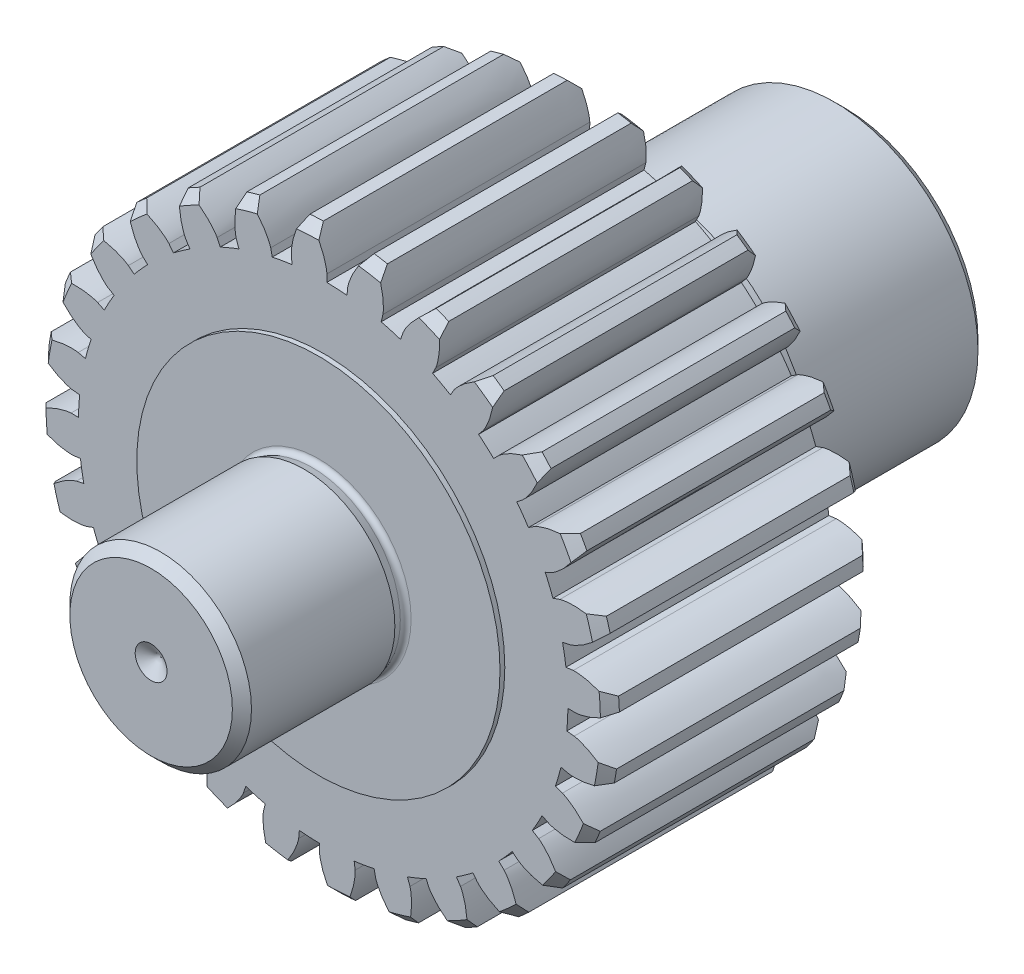
from build123d import *
from build123d.topology import SkipClean

# Parameters (mm, degrees)
CUT_EXTRUDE1_START = -72.5
CUT_EXTRUDE1_DEPTH = 72.5
CUT_EXTRUDE2_START = -25
CUT_EXTRUDE2_DEPTH = 25


with BuildPart() as part:
    # Sketch1 → Revolve1 (revolve)
    with BuildSketch(Plane(origin=(0, 0, 0), x_dir=(0, 0, -1), z_dir=(1, 0, 0))):
        with BuildLine():
            Line((1, 0), (0, 1.664279482))
            Line((0, 1.664279482), (0, 8.5))
            Line((0, 8.5), (1, 9.5))
            Line((1, 9.5), (16, 9.5))
            Line((16, 9.5), (16.845078792, 9.224606038))
            ThreePointArc((16.845078792, 9.224606038), (17.293717038, 9.295363988), (17.5, 9.7))
            Line((17.5, 9.7), (17.5, 19))
            Line((17.5, 19), (18, 19))
            Line((18, 19), (18, 29))
            Line((18, 29), (19, 30))
            Line((19, 30), (44.5, 30))
            Line((44.5, 30), (45.5, 29))
            Line((45.5, 29), (45.5, 18))
            Line((45.5, 18), (51.5, 18))
            Line((51.5, 18), (51.5, 15.15))
            ThreePointArc((51.5, 15.15), (51.691002015, 14.756909368), (52.118080981, 14.664143147))
            Line((52.118080981, 14.664143147), (53.5, 15))
            Line((53.5, 15), (71.5, 15))
            Line((71.5, 15), (72.5, 14))
            Line((72.5, 14), (72.5, 9.177350269))
            Line((72.5, 9.177350269), (71.5, 8.6))
            Line((71.5, 8.6), (67.5, 8.6))
            Line((67.5, 8.6), (66.576239569, 7))
            Line((66.576239569, 7), (50.923760431, 7))
            Line((50.923760431, 7), (50, 8.6))
            Line((50, 8.6), (46, 8.6))
            Line((46, 8.6), (40.832598676, 0))
            Line((40.832598676, 0), (1, 0))
        make_face()
    revolve(axis=Axis((0, 0, 0), (0, 0, -1)))

    # Sketch3 → Cut-Extrude1 (cut)
    with BuildSketch(Plane.XY.offset(CUT_EXTRUDE1_START)):
        with BuildLine():
            add(Edge.make_bspline(
                [(-0.977331043, 29.984076174), (-0.885897241, 29.829762293), (-0.648918395, 29.410274054), (-0.330704202, 28.744625937), (-0.001857606, 28.049280471), (0.186623595, 27.448352917), (0.323198987, 26.907146542), (0.377676599, 26.562123625), (0.389875383, 26.376777171)],
                knots=[0.437527056, 0.437527056, 0.437527056, 0.437527056, 0.515358811, 0.646608382, 0.757768736, 0.848729021, 0.919420974, 1, 1, 1, 1], degree=3))
            Line((0.389875383, 26.376777171), (0.378352504, 25.597203937))
            ThreePointArc((0.378352504, 25.597203937), (1.436130374, 25.559685631), (2.491453258, 25.478474457))
            Line((2.491453258, 25.478474457), (2.567331478, 26.254431737))
            add(Edge.make_bspline(
                [(4.330025689, 29.685869998), (4.221881001, 29.542769901), (3.939402275, 29.152468556), (3.5486244, 28.526656845), (3.143954327, 27.872525711), (2.889342952, 27.296494345), (2.693000709, 26.773993722), (2.600216176, 26.43724507), (2.567331478, 26.254431737)],
                knots=[0.437527061, 0.437527061, 0.437527061, 0.437527061, 0.515358811, 0.646608382, 0.757768736, 0.848729021, 0.919420974, 1, 1, 1, 1], degree=3))
            ThreePointArc((4.330025689, 29.685869998), (1.682965263, 29.9527566), (-0.977331043, 29.984076174))
        make_face()
        with BuildLine():
            ThreePointArc((-5.32704731, 25.039619944), (-4.287441532, 25.23842002), (-3.240506609, 25.394076414))
            Line((-3.240506609, 25.394076414), (-3.339197553, 26.167463317))
            add(Edge.make_bspline(
                [(-2.384264613, 29.905104619), (-2.45785512, 29.741527883), (-2.646401295, 29.298154777), (-2.888125346, 28.601077215), (-3.137091625, 27.873298951), (-3.257140324, 27.255053534), (-3.33229253, 26.701962833), (-3.347817137, 26.353010672), (-3.339197553, 26.167463317)],
                knots=[0.437527061, 0.437527061, 0.437527061, 0.437527061, 0.515358811, 0.646608382, 0.757768736, 0.848729021, 0.919420974, 1, 1, 1, 1], degree=3))
            ThreePointArc((-2.384264613, 29.905104619), (-5.024345563, 29.576273458), (-7.624911948, 29.014836167))
            add(Edge.make_bspline(
                [(-7.624911948, 29.014836167), (-7.501432513, 28.884737191), (-7.177050306, 28.528499153), (-6.718693767, 27.950349544), (-6.243363119, 27.345613091), (-5.925888575, 26.801693059), (-5.672307665, 26.304446742), (-5.542421099, 25.980196678), (-5.489284698, 25.802211732)],
                knots=[0.437527056, 0.437527056, 0.437527056, 0.437527056, 0.515358811, 0.646608382, 0.757768736, 0.848729021, 0.919420974, 1, 1, 1, 1], degree=3))
            Line((-5.489284698, 25.802211732), (-5.32704731, 25.039619944))
        make_face()
        with BuildLine():
            Line((6.249485484, 25.628700863), (6.064780143, 24.871237239))
            ThreePointArc((6.064780143, 24.871237239), (7.087688705, 24.599281876), (8.098481255, 24.285275402))
            Line((8.098481255, 24.285275402), (8.345123789, 25.024893321))
            add(Edge.make_bspline(
                [(10.827190422, 27.978061898), (10.68991438, 27.862614077), (10.327667765, 27.54495583), (9.807431302, 27.021790783), (9.267349281, 26.474107645), (8.890942507, 25.96917495), (8.583255647, 25.503464767), (8.417863792, 25.195805608), (8.345123789, 25.024893321)],
                knots=[0.437527061, 0.437527061, 0.437527061, 0.437527061, 0.515358811, 0.646608382, 0.757768736, 0.848729021, 0.919420974, 1, 1, 1, 1], degree=3))
            ThreePointArc((10.827190422, 27.978061898), (8.305885183, 28.827283454), (5.719257321, 29.4497894))
            add(Edge.make_bspline(
                [(5.719257321, 29.4497894), (5.774060617, 29.278998554), (5.911752995, 28.817295008), (6.073868253, 28.097526759), (6.239741055, 27.346439804), (6.289777678, 26.718637745), (6.302499092, 26.160609661), (6.278836015, 25.812114779), (6.249485484, 25.628700863)],
                knots=[0.437527056, 0.437527056, 0.437527056, 0.437527056, 0.515358811, 0.646608382, 0.757768736, 0.848729021, 0.919420974, 1, 1, 1, 1], degree=3))
        make_face()
        with BuildLine():
            ThreePointArc((-10.765326728, 23.226444851), (-9.796023215, 23.651594643), (-8.809973943, 24.036313343))
            Line((-8.809973943, 24.036313343), (-9.078285275, 24.768349021))
            add(Edge.make_bspline(
                [(-8.978997931, 28.624772421), (-9.014344123, 28.448921467), (-9.099503254, 27.97470918), (-9.180052428, 27.241320146), (-9.260830703, 26.476388594), (-9.240296983, 25.846930531), (-9.190490707, 25.29098403), (-9.127976919, 24.947326278), (-9.078285275, 24.768349021)],
                knots=[0.437527061, 0.437527061, 0.437527061, 0.437527061, 0.515358811, 0.646608382, 0.757768736, 0.848729021, 0.919420974, 1, 1, 1, 1], degree=3))
            ThreePointArc((-8.978997931, 28.624772421), (-11.479714722, 27.716712465), (-13.890147928, 26.590671118))
            add(Edge.make_bspline(
                [(-13.890147928, 26.590671118), (-13.740814635, 26.491310755), (-13.345294947, 26.21618618), (-12.769779972, 25.754525913), (-12.171800335, 25.270722486), (-11.741251947, 24.811084396), (-11.383381125, 24.382732143), (-11.18459866, 24.095514186), (-11.093189123, 23.933815656)],
                knots=[0.437527056, 0.437527056, 0.437527056, 0.437527056, 0.515358811, 0.646608382, 0.757768736, 0.848729021, 0.919420974, 1, 1, 1, 1], degree=3))
            Line((-11.093189123, 23.933815656), (-10.765326728, 23.226444851))
        make_face()
        with BuildLine():
            Line((11.795720287, 23.595494478), (11.447094382, 22.898122853))
            ThreePointArc((11.447094382, 22.898122853), (12.383840729, 22.40536741), (13.299417586, 21.874311232))
            Line((13.299417586, 21.874311232), (13.704456746, 22.540502258))
            add(Edge.make_bspline(
                [(16.781434616, 24.867316948), (16.621910814, 24.785310438), (16.198060869, 24.556224002), (15.574452645, 24.161939299), (14.926040645, 23.748167276), (14.446713079, 23.339652684), (14.043110307, 22.954085596), (13.813404567, 22.690943245), (13.704456746, 22.540502258)],
                knots=[0.437527061, 0.437527061, 0.437527061, 0.437527061, 0.515358811, 0.646608382, 0.757768736, 0.848729021, 0.919420974, 1, 1, 1, 1], degree=3))
            ThreePointArc((16.781434616, 24.867316948), (14.512313338, 26.256289943), (12.129058241, 27.438767213))
            add(Edge.make_bspline(
                [(12.129058241, 27.438767213), (12.144482966, 27.26006357), (12.175984404, 26.779296459), (12.173871591, 26.041500265), (12.168453045, 25.272334456), (12.077536045, 24.64913851), (11.965765576, 24.102270574), (11.865148375, 23.767778716), (11.795720287, 23.595494478)],
                knots=[0.437527056, 0.437527056, 0.437527056, 0.437527056, 0.515358811, 0.646608382, 0.757768736, 0.848729021, 0.919420974, 1, 1, 1, 1], degree=3))
        make_face()
        with BuildLine():
            ThreePointArc((-15.663787712, 20.248598828), (-14.813391391, 20.87877955), (-13.937672397, 21.473269154))
            Line((-13.937672397, 21.473269154), (-14.362149866, 22.127246281))
            add(Edge.make_bspline(
                [(-15.1234868, 25.909074608), (-15.11881627, 25.729767337), (-15.096318123, 25.248494852), (-15.011653348, 24.515569535), (-14.92019306, 23.751841557), (-14.760106567, 23.142734504), (-14.587839304, 22.611809681), (-14.450421823, 22.290678774), (-14.362149866, 22.127246281)],
                knots=[0.437527061, 0.437527061, 0.437527061, 0.437527061, 0.515358811, 0.646608382, 0.757768736, 0.848729021, 0.919420974, 1, 1, 1, 1], degree=3))
            ThreePointArc((-15.1234868, 25.909074608), (-17.359443051, 24.467319775), (-19.458873891, 22.833138787))
            add(Edge.make_bspline(
                [(-19.458873891, 22.833138787), (-19.291174935, 22.769499379), (-18.844350773, 22.589284162), (-18.180536087, 22.267262812), (-17.489892658, 21.928652334), (-16.967859919, 21.576344361), (-16.523644323, 21.238365542), (-16.265933741, 21.002581999), (-16.140834724, 20.865278124)],
                knots=[0.437527056, 0.437527056, 0.437527056, 0.437527056, 0.515358811, 0.646608382, 0.757768736, 0.848729021, 0.919420974, 1, 1, 1, 1], degree=3))
            Line((-16.140834724, 20.865278124), (-15.663787712, 20.248598828))
        make_face()
        with BuildLine():
            Line((16.750468421, 20.379111474), (16.255403509, 19.776800973))
            ThreePointArc((16.255403509, 19.776800973), (17.059015269, 19.087954266), (17.833465585, 18.366477758))
            Line((17.833465585, 18.366477758), (18.376591017, 18.925836292))
            add(Edge.make_bspline(
                [(21.894187606, 20.50962089), (21.720415234, 20.465167839), (21.256215564, 20.336140565), (20.5605059, 20.090507287), (19.836278005, 19.831394636), (19.278065134, 19.539782776), (18.798784777, 19.253692725), (18.516283558, 19.048262237), (18.376591017, 18.925836292)],
                knots=[0.437527061, 0.437527061, 0.437527061, 0.437527061, 0.515358811, 0.646608382, 0.757768736, 0.848729021, 0.919420974, 1, 1, 1, 1], degree=3))
            ThreePointArc((21.894187606, 20.50962089), (19.991033504, 22.368696418), (17.930657534, 24.051850664))
            add(Edge.make_bspline(
                [(17.930657534, 24.051850664), (17.905930228, 23.87419517), (17.829661112, 23.398472165), (17.663426174, 22.679644207), (17.486987988, 21.930968731), (17.259676323, 21.343628544), (17.029018609, 20.835342998), (16.856492651, 20.531626983), (16.750468421, 20.379111474)],
                knots=[0.437527056, 0.437527056, 0.437527056, 0.437527056, 0.515358811, 0.646608382, 0.757768736, 0.848729021, 0.919420974, 1, 1, 1, 1], degree=3))
        make_face()
        with BuildLine():
            ThreePointArc((-19.776800973, 16.255403509), (-19.087954266, 17.059015269), (-18.366477758, 17.833465585))
            Line((-18.366477758, 17.833465585), (-18.925836292, 18.376591017))
            add(Edge.make_bspline(
                [(-20.50962089, 21.894187606), (-20.465167839, 21.720415234), (-20.336140565, 21.256215564), (-20.090507287, 20.5605059), (-19.831394636, 19.836278005), (-19.539782776, 19.278065134), (-19.253692725, 18.798784777), (-19.048262237, 18.516283558), (-18.925836292, 18.376591017)],
                knots=[0.437527061, 0.437527061, 0.437527061, 0.437527061, 0.515358811, 0.646608382, 0.757768736, 0.848729021, 0.919420974, 1, 1, 1, 1], degree=3))
            ThreePointArc((-20.50962089, 21.894187606), (-22.368696418, 19.991033504), (-24.051850664, 17.930657534))
            add(Edge.make_bspline(
                [(-24.051850664, 17.930657534), (-23.87419517, 17.905930228), (-23.398472165, 17.829661112), (-22.679644207, 17.663426174), (-21.930968731, 17.486987988), (-21.343628544, 17.259676323), (-20.835342998, 17.029018609), (-20.531626983, 16.856492651), (-20.379111474, 16.750468421)],
                knots=[0.437527056, 0.437527056, 0.437527056, 0.437527056, 0.515358811, 0.646608382, 0.757768736, 0.848729021, 0.919420974, 1, 1, 1, 1], degree=3))
            Line((-20.379111474, 16.750468421), (-19.776800973, 16.255403509))
        make_face()
        with BuildLine():
            Line((20.865278124, 16.140834724), (20.248598828, 15.663787712))
            ThreePointArc((20.248598828, 15.663787712), (20.87877955, 14.813391391), (21.473269154, 13.937672397))
            Line((21.473269154, 13.937672397), (22.127246281, 14.362149866))
            add(Edge.make_bspline(
                [(25.909074608, 15.1234868), (25.729767337, 15.11881627), (25.248494852, 15.096318123), (24.515569535, 15.011653348), (23.751841557, 14.92019306), (23.142734504, 14.760106567), (22.611809681, 14.587839304), (22.290678774, 14.450421823), (22.127246281, 14.362149866)],
                knots=[0.437527061, 0.437527061, 0.437527061, 0.437527061, 0.515358811, 0.646608382, 0.757768736, 0.848729021, 0.919420974, 1, 1, 1, 1], degree=3))
            ThreePointArc((25.909074608, 15.1234868), (24.467319775, 17.359443051), (22.833138787, 19.458873891))
            add(Edge.make_bspline(
                [(22.833138787, 19.458873891), (22.769499379, 19.291174935), (22.589284162, 18.844350773), (22.267262812, 18.180536087), (21.928652334, 17.489892658), (21.576344361, 16.967859919), (21.238365542, 16.523644323), (21.002581999, 16.265933741), (20.865278124, 16.140834724)],
                knots=[0.437527056, 0.437527056, 0.437527056, 0.437527056, 0.515358811, 0.646608382, 0.757768736, 0.848729021, 0.919420974, 1, 1, 1, 1], degree=3))
        make_face()
        with BuildLine():
            ThreePointArc((-22.898122853, 11.447094382), (-22.40536741, 12.383840729), (-21.874311232, 13.299417586))
            Line((-21.874311232, 13.299417586), (-22.540502258, 13.704456746))
            add(Edge.make_bspline(
                [(-24.867316948, 16.781434616), (-24.785310438, 16.621910814), (-24.556224002, 16.198060869), (-24.161939299, 15.574452645), (-23.748167276, 14.926040645), (-23.339652684, 14.446713079), (-22.954085596, 14.043110307), (-22.690943245, 13.813404567), (-22.540502258, 13.704456746)],
                knots=[0.437527061, 0.437527061, 0.437527061, 0.437527061, 0.515358811, 0.646608382, 0.757768736, 0.848729021, 0.919420974, 1, 1, 1, 1], degree=3))
            ThreePointArc((-24.867316948, 16.781434616), (-26.256289943, 14.512313338), (-27.438767213, 12.129058241))
            add(Edge.make_bspline(
                [(-27.438767213, 12.129058241), (-27.26006357, 12.144482966), (-26.779296459, 12.175984404), (-26.041500265, 12.173871591), (-25.272334456, 12.168453045), (-24.64913851, 12.077536045), (-24.102270574, 11.965765576), (-23.767778716, 11.865148375), (-23.595494478, 11.795720287)],
                knots=[0.437527056, 0.437527056, 0.437527056, 0.437527056, 0.515358811, 0.646608382, 0.757768736, 0.848729021, 0.919420974, 1, 1, 1, 1], degree=3))
            Line((-23.595494478, 11.795720287), (-22.898122853, 11.447094382))
        make_face()
        with BuildLine():
            Line((23.933815656, 11.093189123), (23.226444851, 10.765326728))
            ThreePointArc((23.226444851, 10.765326728), (23.651594643, 9.796023215), (24.036313343, 8.809973943))
            Line((24.036313343, 8.809973943), (24.768349021, 9.078285275))
            add(Edge.make_bspline(
                [(28.624772421, 8.978997931), (28.448921467, 9.014344123), (27.97470918, 9.099503254), (27.241320146, 9.180052428), (26.476388594, 9.260830703), (25.846930531, 9.240296983), (25.29098403, 9.190490707), (24.947326278, 9.127976919), (24.768349021, 9.078285275)],
                knots=[0.437527061, 0.437527061, 0.437527061, 0.437527061, 0.515358811, 0.646608382, 0.757768736, 0.848729021, 0.919420974, 1, 1, 1, 1], degree=3))
            ThreePointArc((28.624772421, 8.978997931), (27.716712465, 11.479714722), (26.590671118, 13.890147928))
            add(Edge.make_bspline(
                [(26.590671118, 13.890147928), (26.491310755, 13.740814635), (26.21618618, 13.345294947), (25.754525913, 12.769779972), (25.270722486, 12.171800335), (24.811084396, 11.741251947), (24.382732143, 11.383381125), (24.095514186, 11.18459866), (23.933815656, 11.093189123)],
                knots=[0.437527056, 0.437527056, 0.437527056, 0.437527056, 0.515358811, 0.646608382, 0.757768736, 0.848729021, 0.919420974, 1, 1, 1, 1], degree=3))
        make_face()
        with BuildLine():
            ThreePointArc((-24.871237239, 6.064780143), (-24.599281876, 7.087688705), (-24.285275402, 8.098481255))
            Line((-24.285275402, 8.098481255), (-25.024893321, 8.345123789))
            add(Edge.make_bspline(
                [(-27.978061898, 10.827190422), (-27.862614077, 10.68991438), (-27.54495583, 10.327667765), (-27.021790783, 9.807431302), (-26.474107645, 9.267349281), (-25.96917495, 8.890942507), (-25.503464767, 8.583255647), (-25.195805608, 8.417863792), (-25.024893321, 8.345123789)],
                knots=[0.437527061, 0.437527061, 0.437527061, 0.437527061, 0.515358811, 0.646608382, 0.757768736, 0.848729021, 0.919420974, 1, 1, 1, 1], degree=3))
            ThreePointArc((-27.978061898, 10.827190422), (-28.827283454, 8.305885183), (-29.4497894, 5.719257321))
            add(Edge.make_bspline(
                [(-29.4497894, 5.719257321), (-29.278998554, 5.774060617), (-28.817295008, 5.911752995), (-28.097526759, 6.073868253), (-27.346439804, 6.239741055), (-26.718637745, 6.289777678), (-26.160609661, 6.302499092), (-25.812114779, 6.278836015), (-25.628700863, 6.249485484)],
                knots=[0.437527056, 0.437527056, 0.437527056, 0.437527056, 0.515358811, 0.646608382, 0.757768736, 0.848729021, 0.919420974, 1, 1, 1, 1], degree=3))
            Line((-25.628700863, 6.249485484), (-24.871237239, 6.064780143))
        make_face()
        with BuildLine():
            Line((25.802211732, 5.489284698), (25.039619944, 5.32704731))
            ThreePointArc((25.039619944, 5.32704731), (25.23842002, 4.287441532), (25.394076414, 3.240506609))
            Line((25.394076414, 3.240506609), (26.167463317, 3.339197553))
            add(Edge.make_bspline(
                [(29.905104619, 2.384264613), (29.741527883, 2.45785512), (29.298154777, 2.646401295), (28.601077215, 2.888125346), (27.873298951, 3.137091625), (27.255053534, 3.257140324), (26.701962833, 3.33229253), (26.353010672, 3.347817137), (26.167463317, 3.339197553)],
                knots=[0.437527061, 0.437527061, 0.437527061, 0.437527061, 0.515358811, 0.646608382, 0.757768736, 0.848729021, 0.919420974, 1, 1, 1, 1], degree=3))
            ThreePointArc((29.905104619, 2.384264613), (29.576273458, 5.024345563), (29.014836167, 7.624911948))
            add(Edge.make_bspline(
                [(29.014836167, 7.624911948), (28.884737191, 7.501432513), (28.528499153, 7.177050306), (27.950349544, 6.718693767), (27.345613091, 6.243363119), (26.801693059, 5.925888575), (26.304446742, 5.672307665), (25.980196678, 5.542421099), (25.802211732, 5.489284698)],
                knots=[0.437527056, 0.437527056, 0.437527056, 0.437527056, 0.515358811, 0.646608382, 0.757768736, 0.848729021, 0.919420974, 1, 1, 1, 1], degree=3))
        make_face()
        with BuildLine():
            ThreePointArc((-25.597203937, 0.378352504), (-25.559685631, 1.436130374), (-25.478474457, 2.491453258))
            Line((-25.478474457, 2.491453258), (-26.254431737, 2.567331478))
            add(Edge.make_bspline(
                [(-29.685869998, 4.330025689), (-29.542769901, 4.221881001), (-29.152468556, 3.939402275), (-28.526656845, 3.5486244), (-27.872525711, 3.143954327), (-27.296494345, 2.889342952), (-26.773993722, 2.693000709), (-26.43724507, 2.600216176), (-26.254431737, 2.567331478)],
                knots=[0.437527061, 0.437527061, 0.437527061, 0.437527061, 0.515358811, 0.646608382, 0.757768736, 0.848729021, 0.919420974, 1, 1, 1, 1], degree=3))
            ThreePointArc((-29.685869998, 4.330025689), (-29.9527566, 1.682965263), (-29.984076174, -0.977331043))
            add(Edge.make_bspline(
                [(-29.984076174, -0.977331043), (-29.829762293, -0.885897241), (-29.410274054, -0.648918395), (-28.744625937, -0.330704202), (-28.049280471, -0.001857606), (-27.448352917, 0.186623595), (-26.907146542, 0.323198987), (-26.562123625, 0.377676599), (-26.376777171, 0.389875383)],
                knots=[0.437527056, 0.437527056, 0.437527056, 0.437527056, 0.515358811, 0.646608382, 0.757768736, 0.848729021, 0.919420974, 1, 1, 1, 1], degree=3))
            Line((-26.376777171, 0.389875383), (-25.597203937, 0.378352504))
        make_face()
        with BuildLine():
            ThreePointArc((29.685869998, -4.330025689), (29.9527566, -1.682965263), (29.984076174, 0.977331043))
            add(Edge.make_bspline(
                [(29.984076174, 0.977331043), (29.829762293, 0.885897241), (29.410274054, 0.648918395), (28.744625937, 0.330704202), (28.049280471, 0.001857606), (27.448352917, -0.186623595), (26.907146542, -0.323198987), (26.562123625, -0.377676599), (26.376777171, -0.389875383)],
                knots=[0.437527056, 0.437527056, 0.437527056, 0.437527056, 0.515358811, 0.646608382, 0.757768736, 0.848729021, 0.919420974, 1, 1, 1, 1], degree=3))
            Line((26.376777171, -0.389875383), (25.597203937, -0.378352504))
            ThreePointArc((25.597203937, -0.378352504), (25.559685631, -1.436130374), (25.478474457, -2.491453258))
            Line((25.478474457, -2.491453258), (26.254431737, -2.567331478))
            add(Edge.make_bspline(
                [(29.685869998, -4.330025689), (29.542769901, -4.221881001), (29.152468556, -3.939402275), (28.526656845, -3.5486244), (27.872525711, -3.143954327), (27.296494345, -2.889342952), (26.773993722, -2.693000709), (26.43724507, -2.600216176), (26.254431737, -2.567331478)],
                knots=[0.437527061, 0.437527061, 0.437527061, 0.437527061, 0.515358811, 0.646608382, 0.757768736, 0.848729021, 0.919420974, 1, 1, 1, 1], degree=3))
        make_face()
        with BuildLine():
            ThreePointArc((-25.039619944, -5.32704731), (-25.23842002, -4.287441532), (-25.394076414, -3.240506609))
            Line((-25.394076414, -3.240506609), (-26.167463317, -3.339197553))
            add(Edge.make_bspline(
                [(-29.905104619, -2.384264613), (-29.741527883, -2.45785512), (-29.298154777, -2.646401295), (-28.601077215, -2.888125346), (-27.873298951, -3.137091625), (-27.255053534, -3.257140324), (-26.701962833, -3.33229253), (-26.353010672, -3.347817137), (-26.167463317, -3.339197553)],
                knots=[0.437527061, 0.437527061, 0.437527061, 0.437527061, 0.515358811, 0.646608382, 0.757768736, 0.848729021, 0.919420974, 1, 1, 1, 1], degree=3))
            ThreePointArc((-29.905104619, -2.384264613), (-29.576273458, -5.024345563), (-29.014836167, -7.624911948))
            add(Edge.make_bspline(
                [(-29.014836167, -7.624911948), (-28.884737191, -7.501432513), (-28.528499153, -7.177050306), (-27.950349544, -6.718693767), (-27.345613091, -6.243363119), (-26.801693059, -5.925888575), (-26.304446742, -5.672307665), (-25.980196678, -5.542421099), (-25.802211732, -5.489284698)],
                knots=[0.437527056, 0.437527056, 0.437527056, 0.437527056, 0.515358811, 0.646608382, 0.757768736, 0.848729021, 0.919420974, 1, 1, 1, 1], degree=3))
            Line((-25.802211732, -5.489284698), (-25.039619944, -5.32704731))
        make_face()
        with BuildLine():
            Line((25.628700863, -6.249485484), (24.871237239, -6.064780143))
            ThreePointArc((24.871237239, -6.064780143), (24.599281876, -7.087688705), (24.285275402, -8.098481255))
            Line((24.285275402, -8.098481255), (25.024893321, -8.345123789))
            add(Edge.make_bspline(
                [(27.978061898, -10.827190422), (27.862614077, -10.68991438), (27.54495583, -10.327667765), (27.021790783, -9.807431302), (26.474107645, -9.267349281), (25.96917495, -8.890942507), (25.503464767, -8.583255647), (25.195805608, -8.417863792), (25.024893321, -8.345123789)],
                knots=[0.437527061, 0.437527061, 0.437527061, 0.437527061, 0.515358811, 0.646608382, 0.757768736, 0.848729021, 0.919420974, 1, 1, 1, 1], degree=3))
            ThreePointArc((27.978061898, -10.827190422), (28.827283454, -8.305885183), (29.4497894, -5.719257321))
            add(Edge.make_bspline(
                [(29.4497894, -5.719257321), (29.278998554, -5.774060617), (28.817295008, -5.911752995), (28.097526759, -6.073868253), (27.346439804, -6.239741055), (26.718637745, -6.289777678), (26.160609661, -6.302499092), (25.812114779, -6.278836015), (25.628700863, -6.249485484)],
                knots=[0.437527056, 0.437527056, 0.437527056, 0.437527056, 0.515358811, 0.646608382, 0.757768736, 0.848729021, 0.919420974, 1, 1, 1, 1], degree=3))
        make_face()
        with BuildLine():
            ThreePointArc((-23.226444851, -10.765326728), (-23.651594643, -9.796023215), (-24.036313343, -8.809973943))
            Line((-24.036313343, -8.809973943), (-24.768349021, -9.078285275))
            add(Edge.make_bspline(
                [(-28.624772421, -8.978997931), (-28.448921467, -9.014344123), (-27.97470918, -9.099503254), (-27.241320146, -9.180052428), (-26.476388594, -9.260830703), (-25.846930531, -9.240296983), (-25.29098403, -9.190490707), (-24.947326278, -9.127976919), (-24.768349021, -9.078285275)],
                knots=[0.437527061, 0.437527061, 0.437527061, 0.437527061, 0.515358811, 0.646608382, 0.757768736, 0.848729021, 0.919420974, 1, 1, 1, 1], degree=3))
            ThreePointArc((-28.624772421, -8.978997931), (-27.716712465, -11.479714722), (-26.590671118, -13.890147928))
            add(Edge.make_bspline(
                [(-26.590671118, -13.890147928), (-26.491310755, -13.740814635), (-26.21618618, -13.345294947), (-25.754525913, -12.769779972), (-25.270722486, -12.171800335), (-24.811084396, -11.741251947), (-24.382732143, -11.383381125), (-24.095514186, -11.18459866), (-23.933815656, -11.093189123)],
                knots=[0.437527056, 0.437527056, 0.437527056, 0.437527056, 0.515358811, 0.646608382, 0.757768736, 0.848729021, 0.919420974, 1, 1, 1, 1], degree=3))
            Line((-23.933815656, -11.093189123), (-23.226444851, -10.765326728))
        make_face()
        with BuildLine():
            Line((23.595494478, -11.795720287), (22.898122853, -11.447094382))
            ThreePointArc((22.898122853, -11.447094382), (22.40536741, -12.383840729), (21.874311232, -13.299417586))
            Line((21.874311232, -13.299417586), (22.540502258, -13.704456746))
            add(Edge.make_bspline(
                [(24.867316948, -16.781434616), (24.785310438, -16.621910814), (24.556224002, -16.198060869), (24.161939299, -15.574452645), (23.748167276, -14.926040645), (23.339652684, -14.446713079), (22.954085596, -14.043110307), (22.690943245, -13.813404567), (22.540502258, -13.704456746)],
                knots=[0.437527061, 0.437527061, 0.437527061, 0.437527061, 0.515358811, 0.646608382, 0.757768736, 0.848729021, 0.919420974, 1, 1, 1, 1], degree=3))
            ThreePointArc((24.867316948, -16.781434616), (26.256289943, -14.512313338), (27.438767213, -12.129058241))
            add(Edge.make_bspline(
                [(27.438767213, -12.129058241), (27.26006357, -12.144482966), (26.779296459, -12.175984404), (26.041500265, -12.173871591), (25.272334456, -12.168453045), (24.64913851, -12.077536045), (24.102270574, -11.965765576), (23.767778716, -11.865148375), (23.595494478, -11.795720287)],
                knots=[0.437527056, 0.437527056, 0.437527056, 0.437527056, 0.515358811, 0.646608382, 0.757768736, 0.848729021, 0.919420974, 1, 1, 1, 1], degree=3))
        make_face()
        with BuildLine():
            ThreePointArc((-20.248598828, -15.663787712), (-20.87877955, -14.813391391), (-21.473269154, -13.937672397))
            Line((-21.473269154, -13.937672397), (-22.127246281, -14.362149866))
            add(Edge.make_bspline(
                [(-25.909074608, -15.1234868), (-25.729767337, -15.11881627), (-25.248494852, -15.096318123), (-24.515569535, -15.011653348), (-23.751841557, -14.92019306), (-23.142734504, -14.760106567), (-22.611809681, -14.587839304), (-22.290678774, -14.450421823), (-22.127246281, -14.362149866)],
                knots=[0.437527061, 0.437527061, 0.437527061, 0.437527061, 0.515358811, 0.646608382, 0.757768736, 0.848729021, 0.919420974, 1, 1, 1, 1], degree=3))
            ThreePointArc((-25.909074608, -15.1234868), (-24.467319775, -17.359443051), (-22.833138787, -19.458873891))
            add(Edge.make_bspline(
                [(-22.833138787, -19.458873891), (-22.769499379, -19.291174935), (-22.589284162, -18.844350773), (-22.267262812, -18.180536087), (-21.928652334, -17.489892658), (-21.576344361, -16.967859919), (-21.238365542, -16.523644323), (-21.002581999, -16.265933741), (-20.865278124, -16.140834724)],
                knots=[0.437527056, 0.437527056, 0.437527056, 0.437527056, 0.515358811, 0.646608382, 0.757768736, 0.848729021, 0.919420974, 1, 1, 1, 1], degree=3))
            Line((-20.865278124, -16.140834724), (-20.248598828, -15.663787712))
        make_face()
        with BuildLine():
            Line((20.379111474, -16.750468421), (19.776800973, -16.255403509))
            ThreePointArc((19.776800973, -16.255403509), (19.087954266, -17.059015269), (18.366477758, -17.833465585))
            Line((18.366477758, -17.833465585), (18.925836292, -18.376591017))
            add(Edge.make_bspline(
                [(20.50962089, -21.894187606), (20.465167839, -21.720415234), (20.336140565, -21.256215564), (20.090507287, -20.5605059), (19.831394636, -19.836278005), (19.539782776, -19.278065134), (19.253692725, -18.798784777), (19.048262237, -18.516283558), (18.925836292, -18.376591017)],
                knots=[0.437527061, 0.437527061, 0.437527061, 0.437527061, 0.515358811, 0.646608382, 0.757768736, 0.848729021, 0.919420974, 1, 1, 1, 1], degree=3))
            ThreePointArc((20.50962089, -21.894187606), (22.368696418, -19.991033504), (24.051850664, -17.930657534))
            add(Edge.make_bspline(
                [(24.051850664, -17.930657534), (23.87419517, -17.905930228), (23.398472165, -17.829661112), (22.679644207, -17.663426174), (21.930968731, -17.486987988), (21.343628544, -17.259676323), (20.835342998, -17.029018609), (20.531626983, -16.856492651), (20.379111474, -16.750468421)],
                knots=[0.437527056, 0.437527056, 0.437527056, 0.437527056, 0.515358811, 0.646608382, 0.757768736, 0.848729021, 0.919420974, 1, 1, 1, 1], degree=3))
        make_face()
        with BuildLine():
            ThreePointArc((-16.255403509, -19.776800973), (-17.059015269, -19.087954266), (-17.833465585, -18.366477758))
            Line((-17.833465585, -18.366477758), (-18.376591017, -18.925836292))
            add(Edge.make_bspline(
                [(-21.894187606, -20.50962089), (-21.720415234, -20.465167839), (-21.256215564, -20.336140565), (-20.5605059, -20.090507287), (-19.836278005, -19.831394636), (-19.278065134, -19.539782776), (-18.798784777, -19.253692725), (-18.516283558, -19.048262237), (-18.376591017, -18.925836292)],
                knots=[0.437527061, 0.437527061, 0.437527061, 0.437527061, 0.515358811, 0.646608382, 0.757768736, 0.848729021, 0.919420974, 1, 1, 1, 1], degree=3))
            ThreePointArc((-21.894187606, -20.50962089), (-19.991033504, -22.368696418), (-17.930657534, -24.051850664))
            add(Edge.make_bspline(
                [(-17.930657534, -24.051850664), (-17.905930228, -23.87419517), (-17.829661112, -23.398472165), (-17.663426174, -22.679644207), (-17.486987988, -21.930968731), (-17.259676323, -21.343628544), (-17.029018609, -20.835342998), (-16.856492651, -20.531626983), (-16.750468421, -20.379111474)],
                knots=[0.437527056, 0.437527056, 0.437527056, 0.437527056, 0.515358811, 0.646608382, 0.757768736, 0.848729021, 0.919420974, 1, 1, 1, 1], degree=3))
            Line((-16.750468421, -20.379111474), (-16.255403509, -19.776800973))
        make_face()
        with BuildLine():
            Line((16.140834724, -20.865278124), (15.663787712, -20.248598828))
            ThreePointArc((15.663787712, -20.248598828), (14.813391391, -20.87877955), (13.937672397, -21.473269154))
            Line((13.937672397, -21.473269154), (14.362149866, -22.127246281))
            add(Edge.make_bspline(
                [(15.1234868, -25.909074608), (15.11881627, -25.729767337), (15.096318123, -25.248494852), (15.011653348, -24.515569535), (14.92019306, -23.751841557), (14.760106567, -23.142734504), (14.587839304, -22.611809681), (14.450421823, -22.290678774), (14.362149866, -22.127246281)],
                knots=[0.437527061, 0.437527061, 0.437527061, 0.437527061, 0.515358811, 0.646608382, 0.757768736, 0.848729021, 0.919420974, 1, 1, 1, 1], degree=3))
            ThreePointArc((15.1234868, -25.909074608), (17.359443051, -24.467319775), (19.458873891, -22.833138787))
            add(Edge.make_bspline(
                [(19.458873891, -22.833138787), (19.291174935, -22.769499379), (18.844350773, -22.589284162), (18.180536087, -22.267262812), (17.489892658, -21.928652334), (16.967859919, -21.576344361), (16.523644323, -21.238365542), (16.265933741, -21.002581999), (16.140834724, -20.865278124)],
                knots=[0.437527056, 0.437527056, 0.437527056, 0.437527056, 0.515358811, 0.646608382, 0.757768736, 0.848729021, 0.919420974, 1, 1, 1, 1], degree=3))
        make_face()
        with BuildLine():
            ThreePointArc((-11.447094382, -22.898122853), (-12.383840729, -22.40536741), (-13.299417586, -21.874311232))
            Line((-13.299417586, -21.874311232), (-13.704456746, -22.540502258))
            add(Edge.make_bspline(
                [(-16.781434616, -24.867316948), (-16.621910814, -24.785310438), (-16.198060869, -24.556224002), (-15.574452645, -24.161939299), (-14.926040645, -23.748167276), (-14.446713079, -23.339652684), (-14.043110307, -22.954085596), (-13.813404567, -22.690943245), (-13.704456746, -22.540502258)],
                knots=[0.437527061, 0.437527061, 0.437527061, 0.437527061, 0.515358811, 0.646608382, 0.757768736, 0.848729021, 0.919420974, 1, 1, 1, 1], degree=3))
            ThreePointArc((-16.781434616, -24.867316948), (-14.512313338, -26.256289943), (-12.129058241, -27.438767213))
            add(Edge.make_bspline(
                [(-12.129058241, -27.438767213), (-12.144482966, -27.26006357), (-12.175984404, -26.779296459), (-12.173871591, -26.041500265), (-12.168453045, -25.272334456), (-12.077536045, -24.64913851), (-11.965765576, -24.102270574), (-11.865148375, -23.767778716), (-11.795720287, -23.595494478)],
                knots=[0.437527056, 0.437527056, 0.437527056, 0.437527056, 0.515358811, 0.646608382, 0.757768736, 0.848729021, 0.919420974, 1, 1, 1, 1], degree=3))
            Line((-11.795720287, -23.595494478), (-11.447094382, -22.898122853))
        make_face()
        with BuildLine():
            Line((11.093189123, -23.933815656), (10.765326728, -23.226444851))
            ThreePointArc((10.765326728, -23.226444851), (9.796023215, -23.651594643), (8.809973943, -24.036313343))
            Line((8.809973943, -24.036313343), (9.078285275, -24.768349021))
            add(Edge.make_bspline(
                [(8.978997931, -28.624772421), (9.014344123, -28.448921467), (9.099503254, -27.97470918), (9.180052428, -27.241320146), (9.260830703, -26.476388594), (9.240296983, -25.846930531), (9.190490707, -25.29098403), (9.127976919, -24.947326278), (9.078285275, -24.768349021)],
                knots=[0.437527061, 0.437527061, 0.437527061, 0.437527061, 0.515358811, 0.646608382, 0.757768736, 0.848729021, 0.919420974, 1, 1, 1, 1], degree=3))
            ThreePointArc((8.978997931, -28.624772421), (11.479714722, -27.716712465), (13.890147928, -26.590671118))
            add(Edge.make_bspline(
                [(13.890147928, -26.590671118), (13.740814635, -26.491310755), (13.345294947, -26.21618618), (12.769779972, -25.754525913), (12.171800335, -25.270722486), (11.741251947, -24.811084396), (11.383381125, -24.382732143), (11.18459866, -24.095514186), (11.093189123, -23.933815656)],
                knots=[0.437527056, 0.437527056, 0.437527056, 0.437527056, 0.515358811, 0.646608382, 0.757768736, 0.848729021, 0.919420974, 1, 1, 1, 1], degree=3))
        make_face()
        with BuildLine():
            ThreePointArc((-6.064780143, -24.871237239), (-7.087688705, -24.599281876), (-8.098481255, -24.285275402))
            Line((-8.098481255, -24.285275402), (-8.345123789, -25.024893321))
            add(Edge.make_bspline(
                [(-10.827190422, -27.978061898), (-10.68991438, -27.862614077), (-10.327667765, -27.54495583), (-9.807431302, -27.021790783), (-9.267349281, -26.474107645), (-8.890942507, -25.96917495), (-8.583255647, -25.503464767), (-8.417863792, -25.195805608), (-8.345123789, -25.024893321)],
                knots=[0.437527061, 0.437527061, 0.437527061, 0.437527061, 0.515358811, 0.646608382, 0.757768736, 0.848729021, 0.919420974, 1, 1, 1, 1], degree=3))
            ThreePointArc((-10.827190422, -27.978061898), (-8.305885183, -28.827283454), (-5.719257321, -29.4497894))
            add(Edge.make_bspline(
                [(-5.719257321, -29.4497894), (-5.774060617, -29.278998554), (-5.911752995, -28.817295008), (-6.073868253, -28.097526759), (-6.239741055, -27.346439804), (-6.289777678, -26.718637745), (-6.302499092, -26.160609661), (-6.278836015, -25.812114779), (-6.249485484, -25.628700863)],
                knots=[0.437527056, 0.437527056, 0.437527056, 0.437527056, 0.515358811, 0.646608382, 0.757768736, 0.848729021, 0.919420974, 1, 1, 1, 1], degree=3))
            Line((-6.249485484, -25.628700863), (-6.064780143, -24.871237239))
        make_face()
        with BuildLine():
            Line((5.489284698, -25.802211732), (5.32704731, -25.039619944))
            ThreePointArc((5.32704731, -25.039619944), (4.287441532, -25.23842002), (3.240506609, -25.394076414))
            Line((3.240506609, -25.394076414), (3.339197553, -26.167463317))
            add(Edge.make_bspline(
                [(2.384264613, -29.905104619), (2.45785512, -29.741527883), (2.646401295, -29.298154777), (2.888125346, -28.601077215), (3.137091625, -27.873298951), (3.257140324, -27.255053534), (3.33229253, -26.701962833), (3.347817137, -26.353010672), (3.339197553, -26.167463317)],
                knots=[0.437527061, 0.437527061, 0.437527061, 0.437527061, 0.515358811, 0.646608382, 0.757768736, 0.848729021, 0.919420974, 1, 1, 1, 1], degree=3))
            ThreePointArc((2.384264613, -29.905104619), (5.024345563, -29.576273458), (7.624911948, -29.014836167))
            add(Edge.make_bspline(
                [(7.624911948, -29.014836167), (7.501432513, -28.884737191), (7.177050306, -28.528499153), (6.718693767, -27.950349544), (6.243363119, -27.345613091), (5.925888575, -26.801693059), (5.672307665, -26.304446742), (5.542421099, -25.980196678), (5.489284698, -25.802211732)],
                knots=[0.437527056, 0.437527056, 0.437527056, 0.437527056, 0.515358811, 0.646608382, 0.757768736, 0.848729021, 0.919420974, 1, 1, 1, 1], degree=3))
        make_face()
        with BuildLine():
            ThreePointArc((-0.378352504, -25.597203937), (-1.436130374, -25.559685631), (-2.491453258, -25.478474457))
            Line((-2.491453258, -25.478474457), (-2.567331478, -26.254431737))
            add(Edge.make_bspline(
                [(-4.330025689, -29.685869998), (-4.221881001, -29.542769901), (-3.939402275, -29.152468556), (-3.5486244, -28.526656845), (-3.143954327, -27.872525711), (-2.889342952, -27.296494345), (-2.693000709, -26.773993722), (-2.600216176, -26.43724507), (-2.567331478, -26.254431737)],
                knots=[0.437527061, 0.437527061, 0.437527061, 0.437527061, 0.515358811, 0.646608382, 0.757768736, 0.848729021, 0.919420974, 1, 1, 1, 1], degree=3))
            ThreePointArc((-4.330025689, -29.685869998), (-1.682965263, -29.9527566), (0.977331043, -29.984076174))
            add(Edge.make_bspline(
                [(0.977331043, -29.984076174), (0.885897241, -29.829762293), (0.648918395, -29.410274054), (0.330704202, -28.744625937), (0.001857606, -28.049280471), (-0.186623595, -27.448352917), (-0.323198987, -26.907146542), (-0.377676599, -26.562123625), (-0.389875383, -26.376777171)],
                knots=[0.437527056, 0.437527056, 0.437527056, 0.437527056, 0.515358811, 0.646608382, 0.757768736, 0.848729021, 0.919420974, 1, 1, 1, 1], degree=3))
            Line((-0.389875383, -26.376777171), (-0.378352504, -25.597203937))
        make_face()
    extrude(amount=CUT_EXTRUDE1_DEPTH, mode=Mode.SUBTRACT)

    # Sketch6 → Cut-Extrude2 (cut)
    with SkipClean():  # the faces are left unmerged after this step: merging them gives an invalid solid
        with BuildSketch(Plane(origin=(0, 0, -72.5), x_dir=(-1, 0, 0), z_dir=(0, 0, -1)).offset(CUT_EXTRUDE2_START)):
            with BuildLine():
                add(Edge.make_bspline(
                    [(8.187551672, 2.631349011), (8.163165289, 2.586733425), (8.036179406, 2.361355051), (7.795234438, 1.9937034), (7.448577187, 1.577975057), (7.152315915, 1.295825926), (6.972777327, 1.154466177), (6.911482157, 1.109691128)],
                    knots=[0.326566683, 0.326566683, 0.326566683, 0.326566683, 0.363635801, 0.515150756, 0.646463753, 0.757574798, 0.812911744, 0.812911744, 0.812911744, 0.812911744], degree=3))
                ThreePointArc((8.187551672, 2.631349011), (8.081616761, 2.940658179), (7.964001492, 3.245717214))
                add(Edge.make_bspline(
                    [(7.964001492, 3.245717214), (7.916645368, 3.26422785), (7.674514222, 3.355295592), (7.253640184, 3.482131141), (6.720877228, 3.577864821), (6.312570517, 3.603642776), (6.084170428, 3.596565864), (6.008433855, 3.591479168)],
                    knots=[0.326566684, 0.326566684, 0.326566684, 0.326566684, 0.363635801, 0.515150756, 0.646463753, 0.757574798, 0.812911744, 0.812911744, 0.812911744, 0.812911744], degree=3))
                ThreePointArc((6.008433855, 3.591479168), (6.578060155, 2.393558981), (6.911482157, 1.109691128))
            make_face()
            with BuildLine():
                ThreePointArc((7.963427002, -3.24712648), (8.081096253, -2.942088263), (8.187085898, -2.632797847))
                add(Edge.make_bspline(
                    [(8.187085898, -2.632797847), (8.16270741, -2.588177948), (8.035761407, -2.362777109), (7.794881508, -1.995082825), (7.448297829, -1.579293144), (7.152086492, -1.29709159), (6.972572922, -1.155700072), (6.911285676, -1.110914177)],
                    knots=[0.326566684, 0.326566684, 0.326566684, 0.326566684, 0.363635801, 0.515150756, 0.646463753, 0.757574798, 0.812911744, 0.812911744, 0.812911744, 0.812911744], degree=3))
                ThreePointArc((6.911285676, -1.110914177), (6.577636484, -2.394723007), (6.007798207, -3.592542373))
                add(Edge.make_bspline(
                    [(7.963427002, -3.24712648), (7.916067603, -3.265628738), (7.673920346, -3.356653637), (7.253023867, -3.4834147), (6.720243978, -3.579054102), (6.311932712, -3.604759801), (6.083533879, -3.597642471), (6.007798207, -3.592542373)],
                    knots=[0.326566683, 0.326566683, 0.326566683, 0.326566683, 0.363635801, 0.515150756, 0.646463753, 0.757574798, 0.812911744, 0.812911744, 0.812911744, 0.812911744], degree=3))
            make_face()
            with BuildLine():
                add(Edge.make_bspline(
                    [(4.58062992, 7.278587056), (4.590627213, 7.22873427), (4.638220809, 6.974459466), (4.689968181, 6.537945522), (4.691638348, 5.99665215), (4.646051013, 5.5900803), (4.59938077, 5.366387271), (4.581206792, 5.292687817)],
                    knots=[0.326566683, 0.326566683, 0.326566683, 0.326566683, 0.363635801, 0.515150756, 0.646463753, 0.757574798, 0.812911744, 0.812911744, 0.812911744, 0.812911744], degree=3))
                ThreePointArc((4.58062992, 7.278587056), (4.30065897, 7.447437977), (4.014472278, 7.605525118))
                add(Edge.make_bspline(
                    [(4.014472278, 7.605525118), (3.966296975, 7.589265159), (3.72227654, 7.503388195), (3.318340003, 7.330017246), (2.848683477, 7.060900072), (2.51933264, 6.818192637), (2.348916973, 6.665958661), (2.294169057, 6.613379495)],
                    knots=[0.326566684, 0.326566684, 0.326566684, 0.326566684, 0.363635801, 0.515150756, 0.646463753, 0.757574798, 0.812911744, 0.812911744, 0.812911744, 0.812911744], degree=3))
                ThreePointArc((2.294169057, 6.613379495), (3.500536372, 6.06186812), (4.581206792, 5.292687817))
            make_face()
            with BuildLine():
                ThreePointArc((4.013126335, -7.606235404), (4.299340997, -7.448198909), (4.579341822, -7.279397535))
                add(Edge.make_bspline(
                    [(4.579341822, -7.279397535), (4.589347936, -7.229546519), (4.636986522, -6.975280141), (4.688811144, -6.538775364), (4.690577098, -5.997482295), (4.645061711, -5.590902385), (4.598431054, -5.3672011), (4.580270119, -5.293498431)],
                    knots=[0.326566684, 0.326566684, 0.326566684, 0.326566684, 0.363635801, 0.515150756, 0.646463753, 0.757574798, 0.812911744, 0.812911744, 0.812911744, 0.812911744], degree=3))
                ThreePointArc((4.580270119, -5.293498431), (3.4994636, -6.062487485), (2.292998707, -6.613785371))
                add(Edge.make_bspline(
                    [(4.013126335, -7.606235404), (3.964953908, -7.58996692), (3.720948671, -7.504046782), (3.31704282, -7.330604349), (2.847433925, -7.06140407), (2.518126043, -6.818638355), (2.347737318, -6.666374224), (2.292998707, -6.613785371)],
                    knots=[0.326566683, 0.326566683, 0.326566683, 0.326566683, 0.363635801, 0.515150756, 0.646463753, 0.757574798, 0.812911744, 0.812911744, 0.812911744, 0.812911744], degree=3))
            make_face()
            with BuildLine():
                add(Edge.make_bspline(
                    [(-1.16961948, 8.520093325), (-1.129916355, 8.488330011), (-0.930012852, 8.324136785), (-0.609786311, 8.023010273), (-0.260570216, 7.609429056), (-0.034152793, 7.268673976), (0.073882835, 7.06731612), (0.107333856, 6.999177055)],
                    knots=[0.326566683, 0.326566683, 0.326566683, 0.326566683, 0.363635801, 0.515150756, 0.646463753, 0.757574798, 0.812911744, 0.812911744, 0.812911744, 0.812911744], degree=3))
                ThreePointArc((-1.16961948, 8.520093325), (-1.49262495, 8.469478777), (-1.81347313, 8.406623294))
                add(Edge.make_bspline(
                    [(-1.81347313, 8.406623294), (-1.839925853, 8.363200954), (-1.971655704, 8.140562071), (-2.169648345, 7.748106818), (-2.356440932, 7.240061707), (-2.452728978, 6.842434387), (-2.485420839, 6.616275316), (-2.49356294, 6.540806056)],
                    knots=[0.326566684, 0.326566684, 0.326566684, 0.326566684, 0.363635801, 0.515150756, 0.646463753, 0.757574798, 0.812911744, 0.812911744, 0.812911744, 0.812911744], degree=3))
                ThreePointArc((-2.49356294, 6.540806056), (-1.214927283, 6.893761796), (0.107333856, 6.999177055))
            make_face()
            with BuildLine():
                ThreePointArc((-1.814960746, -8.406302248), (-1.494123694, -8.469214508), (-1.171127185, -8.519886215))
                add(Edge.make_bspline(
                    [(-1.171127185, -8.519886215), (-1.131418442, -8.488129927), (-0.931485891, -8.323972074), (-0.611206065, -8.02290224), (-0.261916788, -7.609382825), (-0.035439068, -7.268667818), (0.07263219, -7.067329083), (0.106095269, -6.999195939)],
                    knots=[0.326566684, 0.326566684, 0.326566684, 0.326566684, 0.363635801, 0.515150756, 0.646463753, 0.757574798, 0.812911744, 0.812911744, 0.812911744, 0.812911744], degree=3))
                ThreePointArc((0.106095269, -6.999195939), (-1.216147195, -6.893546692), (-2.494720371, -6.540364689))
                add(Edge.make_bspline(
                    [(-1.814960746, -8.406302248), (-1.841405786, -8.362875228), (-1.973096242, -8.14021304), (-2.171019427, -7.747722752), (-2.357722107, -7.239644595), (-2.453939787, -6.842000241), (-2.486591627, -6.615835389), (-2.494720371, -6.540364689)],
                    knots=[0.326566683, 0.326566683, 0.326566683, 0.326566683, 0.363635801, 0.515150756, 0.646463753, 0.757574798, 0.812911744, 0.812911744, 0.812911744, 0.812911744], degree=3))
            make_face()
            with BuildLine():
                add(Edge.make_bspline(
                    [(-6.372590926, 5.774953237), (-6.321759503, 5.776141803), (-6.063083164, 5.778857989), (-5.624215011, 5.754019351), (-5.09085508, 5.661669537), (-4.698376128, 5.546174316), (-4.486185701, 5.461369212), (-4.416761785, 5.430673562)],
                    knots=[0.326566683, 0.326566683, 0.326566683, 0.326566683, 0.363635801, 0.515150756, 0.646463753, 0.757574798, 0.812911744, 0.812911744, 0.812911744, 0.812911744], degree=3))
                ThreePointArc((-6.372590926, 5.774953237), (-6.587493067, 5.528556329), (-6.792874307, 5.274169001))
                add(Edge.make_bspline(
                    [(-6.792874307, 5.274169001), (-6.785226926, 5.223902077), (-6.743028331, 4.968676482), (-6.642434119, 4.540771099), (-6.45896044, 4.031518005), (-6.277131448, 3.665025043), (-6.156802618, 3.47076322), (-6.114529124, 3.407716771)],
                    knots=[0.326566684, 0.326566684, 0.326566684, 0.326566684, 0.363635801, 0.515150756, 0.646463753, 0.757574798, 0.812911744, 0.812911744, 0.812911744, 0.812911744], degree=3))
                ThreePointArc((-6.114529124, 3.407716771), (-5.361912961, 4.499987712), (-4.416761785, 5.430673562))
            make_face()
            with BuildLine():
                ThreePointArc((-6.793807522, -5.272966845), (-6.588471303, -5.527390514), (-6.373612767, -5.773825447))
                add(Edge.make_bspline(
                    [(-6.373612767, -5.773825447), (-6.322781557, -5.775023007), (-6.064105703, -5.777784962), (-5.625233163, -5.753023993), (-5.091856897, -5.660768563), (-4.699357514, -5.545342797), (-4.487152083, -5.460575244), (-4.417722736, -5.42989188)],
                    knots=[0.326566684, 0.326566684, 0.326566684, 0.326566684, 0.363635801, 0.515150756, 0.646463753, 0.757574798, 0.812911744, 0.812911744, 0.812911744, 0.812911744], degree=3))
                ThreePointArc((-4.417722736, -5.42989188), (-5.362709201, -4.499038789), (-6.115132063, -3.406634682))
                add(Edge.make_bspline(
                    [(-6.793807522, -5.272966845), (-6.786151248, -5.222701273), (-6.743907494, -4.967483148), (-6.643237556, -4.539595573), (-6.459673763, -4.030374954), (-6.277779918, -3.663914175), (-6.157416714, -3.469673648), (-6.115132063, -3.406634682)],
                    knots=[0.326566683, 0.326566683, 0.326566683, 0.326566683, 0.363635801, 0.515150756, 0.646463753, 0.757574798, 0.812911744, 0.812911744, 0.812911744, 0.812911744], degree=3))
            make_face()
            with BuildLine():
                add(Edge.make_bspline(
                    [(-8.593756254, 0.327648348), (-8.555581121, 0.361232651), (-8.35916948, 0.529587316), (-8.007011001, 0.792658826), (-7.539072273, 1.06475192), (-7.164177056, 1.228558054), (-6.947118088, 1.299986953), (-6.8742055, 1.321097554)],
                    knots=[0.326566683, 0.326566683, 0.326566683, 0.326566683, 0.363635801, 0.515150756, 0.646463753, 0.757574798, 0.812911744, 0.812911744, 0.812911744, 0.812911744], degree=3))
                ThreePointArc((-8.593756254, 0.327648348), (-8.599999966, 0.000760932), (-8.593814101, -0.326127583))
                add(Edge.make_bspline(
                    [(-8.593814101, -0.326127583), (-8.555644911, -0.35971864), (-8.359263061, -0.528108054), (-8.007151147, -0.791241882), (-7.539260575, -1.063417777), (-7.164394351, -1.227290251), (-6.947348027, -1.298757561), (-6.874439176, -1.319881063)],
                    knots=[0.326566684, 0.326566684, 0.326566684, 0.326566684, 0.363635801, 0.515150756, 0.646463753, 0.757574798, 0.812911744, 0.812911744, 0.812911744, 0.812911744], degree=3))
                ThreePointArc((-6.874439176, -1.319881063), (-6.999999973, 0.000619365), (-6.8742055, 1.321097554))
            make_face()
        extrude(amount=CUT_EXTRUDE2_DEPTH, mode=Mode.SUBTRACT)


solid = part.part
